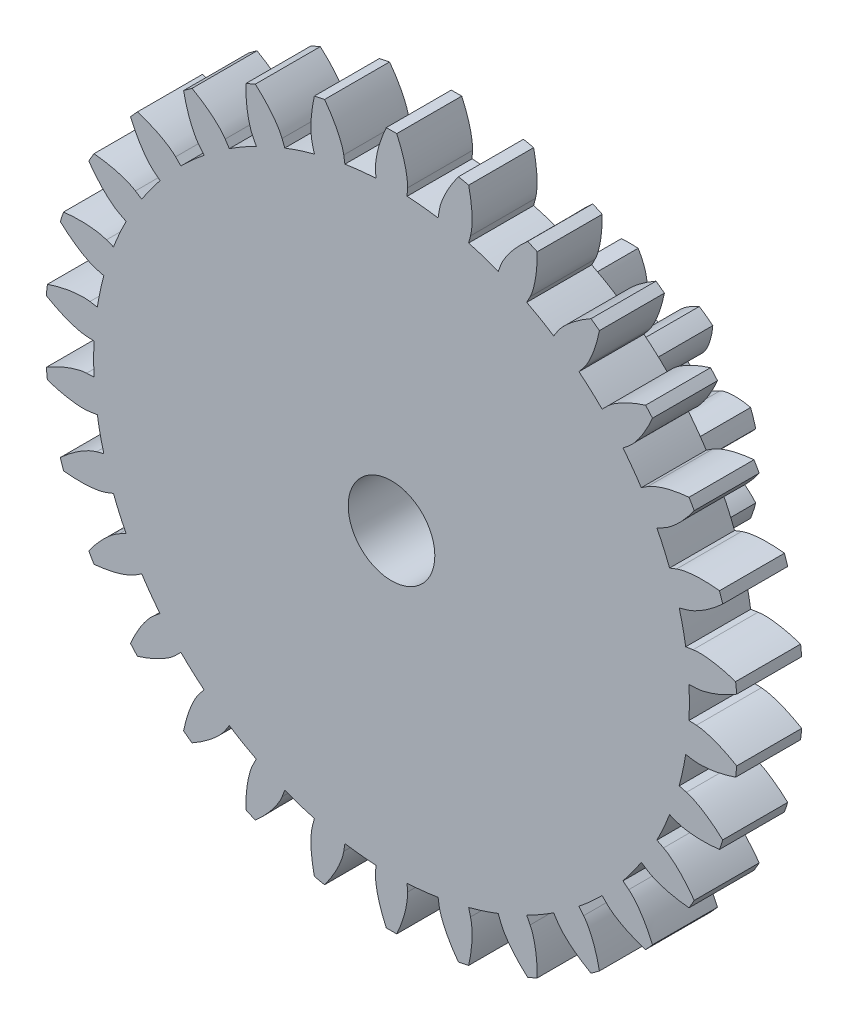
from build123d import *

# Parameters (mm, degrees)
SKETCH_1_R               = 3
SKETCH_1_R_2             = 1
EXTRUDE_1_DEPTH          = 4
CUT_EXTRUDE_1_DEPTH      = 6.830951895
PATTERN_CIRCULAR_1_COUNT = 10
PATTERN_CIRCULAR_1_ANGLE = 324
SKETCH_2_R               = 8
SKETCH_2_R_2             = 1
EXTRUDE_2_DEPTH          = 1.5
CUT_EXTRUDE_3_DEPTH      = 13.000000167
PATTERN_CIRCULAR_2_COUNT = 30


with BuildPart() as part:
    # 草图1 → 凸台-拉伸1 (new body)
    with BuildSketch(Plane.XY):
        Circle(SKETCH_1_R)
        Circle(SKETCH_1_R_2, mode=Mode.SUBTRACT)
    extrude(amount=EXTRUDE_1_DEPTH)

    # 草图1<3> → 切除-拉伸1 (cut, through all)
    with BuildSketch(Plane.XY):
        with BuildLine():
            Line((2.32404424, 0.34308491), (1.854897167, 0.273827502))
            ThreePointArc((1.854897167, 0.273827502), (1.869967538, 0.137282213), (1.875, 0))
            ThreePointArc((1.875, 0), (1.869967538, -0.137282213), (1.854897167, -0.273827502))
            Line((1.854897167, -0.273827502), (2.32404424, -0.34308491))
            add(Edge.make_bspline(
                [(2.32404424, -0.34308491), (2.341759801, -0.345700154), (2.390654467, -0.356680366), (2.480003701, -0.392068726), (2.61555699, -0.468743726), (2.742843787, -0.569725263), (2.835064857, -0.660865824), (2.891013955, -0.723601117), (2.906804856, -0.741947122)],
                knots=[0, 0, 0, 0, 0, 0.005604068, 0.015718248, 0.029959916, 0.048733667, 0.056327581, 0.056327581, 0.056327581, 0.056327581, 0.056327581], degree=4))
            ThreePointArc((2.906804856, -0.741947122), (2.976610032, -0.373888642), (3, 0))
            ThreePointArc((3, 0), (2.976610032, 0.373888642), (2.906804856, 0.741947122))
            add(Edge.make_bspline(
                [(2.32404424, 0.34308491), (2.341759801, 0.345700154), (2.390654467, 0.356680366), (2.480003701, 0.392068726), (2.61555699, 0.468743726), (2.742843787, 0.569725263), (2.835064857, 0.660865824), (2.891013955, 0.723601117), (2.906804856, 0.741947122)],
                knots=[0, 0, 0, 0, 0, 0.005604068, 0.015718248, 0.029959916, 0.048733667, 0.056327581, 0.056327581, 0.056327581, 0.056327581, 0.056327581], degree=4))
        make_face()
    cut_extrude_1 = extrude(amount=CUT_EXTRUDE_1_DEPTH, mode=Mode.SUBTRACT)

    # 阵列(圆周)1: 切除-拉伸1 ×10 about axis
    pattern_circular_1_axis = Axis((0, 0, 4), (0, 0, 1))
    for i in range(1, PATTERN_CIRCULAR_1_COUNT):
        add(cut_extrude_1.rotate(pattern_circular_1_axis, i * PATTERN_CIRCULAR_1_ANGLE / (PATTERN_CIRCULAR_1_COUNT - 1)), mode=Mode.SUBTRACT)

    # 草图2 → 凸台-拉伸2 (add)
    with BuildSketch(Plane.XY.offset(4)):
        Circle(SKETCH_2_R)
        Circle(SKETCH_2_R_2, mode=Mode.SUBTRACT)
    extrude(amount=EXTRUDE_2_DEPTH)

    # 草图2<3> → 切除-拉伸3 (cut, through all)
    with BuildSketch(Plane.XY.offset(4)):
        with BuildLine():
            Line((7.038036035, 0.368847839), (6.865578051, 0.359809699))
            ThreePointArc((6.865578051, 0.359809699), (6.872644109, 0.17996652), (6.875, 0))
            ThreePointArc((6.875, 0), (6.872644109, -0.17996652), (6.865578051, -0.359809699))
            Line((6.865578051, -0.359809699), (7.038036035, -0.368847839))
            add(Edge.make_bspline(
                [(7.038036035, -0.368847839), (7.064832188, -0.370252166), (7.118147622, -0.3755676), (7.266135356, -0.403579841), (7.505235312, -0.479270375), (7.709408423, -0.571203405), (7.882017767, -0.665460477), (7.967862871, -0.716352758)],
                knots=[0, 0, 0, 0, 0, 0.002802034, 0.005604068, 0.015718248, 0.026152267, 0.026152267, 0.026152267, 0.026152267, 0.026152267], degree=4))
            ThreePointArc((7.967862871, -0.716352758), (7.991961679, -0.358536633), (8, 0))
            ThreePointArc((8, 0), (7.991961679, 0.358536633), (7.967862871, 0.716352758))
            add(Edge.make_bspline(
                [(7.038036035, 0.368847839), (7.064832188, 0.370252166), (7.118147622, 0.3755676), (7.266135356, 0.403579841), (7.505235312, 0.479270375), (7.709408423, 0.571203405), (7.882017767, 0.665460477), (7.967862871, 0.716352758)],
                knots=[0, 0, 0, 0, 0, 0.002802034, 0.005604068, 0.015718248, 0.026152267, 0.026152267, 0.026152267, 0.026152267, 0.026152267], degree=4))
        make_face()
    cut_extrude_3 = extrude(amount=CUT_EXTRUDE_3_DEPTH, mode=Mode.SUBTRACT)

    # 阵列(圆周)2: 切除-拉伸3 ×30 about axis
    pattern_circular_2_axis = Axis((0, 0, 5.5), (0, 0, 1))
    for i in range(1, PATTERN_CIRCULAR_2_COUNT):
        add(cut_extrude_3.rotate(pattern_circular_2_axis, i * 360 / PATTERN_CIRCULAR_2_COUNT), mode=Mode.SUBTRACT)


solid = part.part
